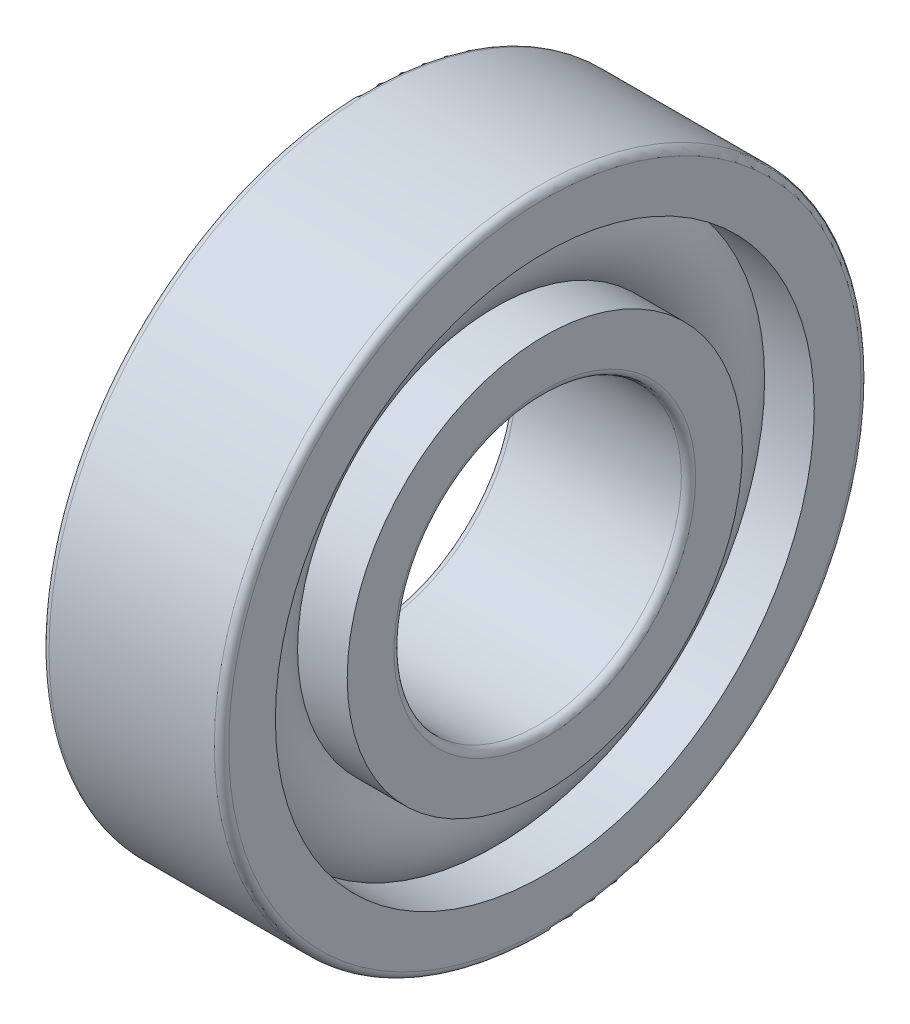
from build123d import *

# Parameters (mm, degrees)
CAGSPISKE_W     = 0.15
CAGSPISKE_H     = 0.25
CAGESPINE_ANGLE = 0.001
BALSIMSKE_R     = 0.75


with BuildPart() as part:
    # CagSpiSke → CageSpine (revolve)
    with BuildSketch(Plane.XY):
        with Locations((0, 3.25)):
            Rectangle(CAGSPISKE_W, CAGSPISKE_H)
    revolve(axis=Axis((-20.6375, 0, 0), (-1, 0, 0)), revolution_arc=CAGESPINE_ANGLE)

    # BalSimSke → BallsSimplified (revolve)
    with BuildSketch(Plane.XY):
        with Locations((0, 3.25)):
            Circle(BALSIMSKE_R)
    revolve(axis=Axis((-10, 0, 0), (1, 0, 0)))

    # InnRacSke → InnerRace (revolve)
    with BuildSketch(Plane.XY):
        with BuildLine():
            Line((-0.525, 2.75), (-1.25, 2.75))
            Line((-1.25, 2.75), (-1.25, 2.1))
            ThreePointArc((-1.25, 2.1), (-1.220710678, 2.029289322), (-1.15, 2))
            Line((-1.15, 2), (1.15, 2))
            ThreePointArc((1.15, 2), (1.220710678, 2.029289322), (1.25, 2.1))
            Line((1.25, 2.1), (1.25, 2.75))
            Line((1.25, 2.75), (0.525, 2.75))
            ThreePointArc((0.525, 2.75), (0, 2.525), (-0.525, 2.75))
        make_face()
    revolve(axis=Axis((-20.6375, 0, 0), (1, 0, 0)))

    # OutRacSke → OuterRace (revolve)
    with BuildSketch(Plane.XY):
        with BuildLine():
            Line((-0.525, 3.75), (-1.25, 3.75))
            Line((-1.25, 3.75), (-1.25, 4.4))
            ThreePointArc((-1.25, 4.4), (-1.220710678, 4.470710678), (-1.15, 4.5))
            Line((-1.15, 4.5), (1.15, 4.5))
            ThreePointArc((1.15, 4.5), (1.220710678, 4.470710678), (1.25, 4.4))
            Line((1.25, 4.4), (1.25, 3.75))
            Line((1.25, 3.75), (0.525, 3.75))
            ThreePointArc((0.525, 3.75), (0, 3.975), (-0.525, 3.75))
        make_face()
    revolve(axis=Axis((-20.6375, 0, 0), (1, 0, 0)))


solid = part.part
